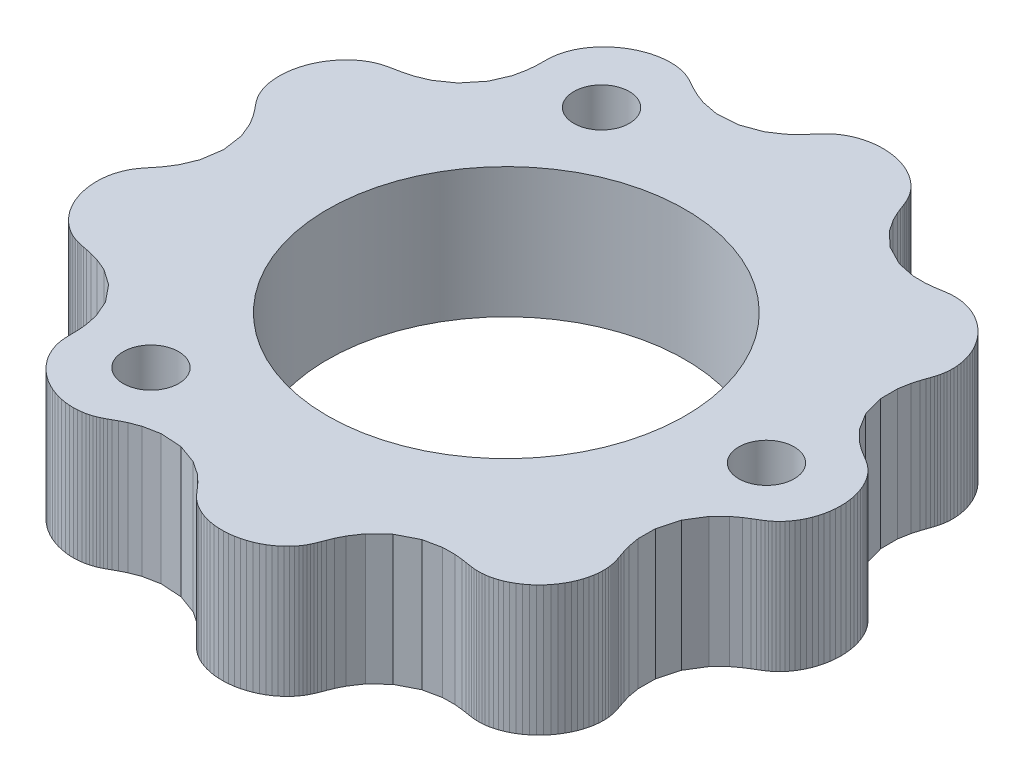
from build123d import *

# Parameters (mm, degrees)
SKETCH1_R           = 8.73125
BOSS_EXTRUDE1_DEPTH = 6.35
SKETCH2_R           = 1.35255
CUT_EXTRUDE1_DEPTH  = 25.155143673


with BuildPart() as part:
    # Sketch1 → Boss-Extrude1 (new body)
    with BuildSketch(Plane(origin=(0, 0, 0), x_dir=(1, 0, 0), z_dir=(0, 1, 0))):
        Polygon((13.158625694, 2.896830869), (12.791263425, 3.170142616), (12.291349818, 3.669343614), (11.77870952, 4.496612993), (11.502906417, 5.500558598), (11.499130591, 6.333845387), (11.598412818, 6.883171823), (11.697750704, 7.22707793), (11.774159157, 7.453194447), (11.830874176, 7.617056094), (11.874650737, 7.750735367), (11.910311798, 7.872982033), (11.94024632, 7.995078537), (11.964947846, 8.123889112), (11.983624956, 8.263460612), (11.994696284, 8.415902035), (11.996165513, 8.58190094), (11.985903403, 8.761053922), (11.961861475, 8.952100578), (11.922234402, 9.15310695), (11.865582106, 9.361622282), (11.790918419, 9.574821298), (11.69777069, 9.789637839), (11.586213208, 10.002892144), (11.456876573, 10.211411964), (11.310934746, 10.412146557), (11.150071414, 10.602271901), (10.976427312, 10.779285127), (10.792530246, 10.941086065), (10.601209599, 11.086043732), (10.40549712, 11.21304574), (10.208515647, 11.32152862), (10.013357043, 11.411487218), (9.82294991, 11.483461233), (9.639916308, 11.53849685), (9.466414428, 11.578080931), (9.30396013, 11.604044362), (9.153213125, 11.618429715), (9.013700532, 11.623316296), (8.883425976, 11.620593564), (8.758264909, 11.6116747), (8.630953094, 11.597157727), (8.489288819, 11.576514925), (8.312816024, 11.548173385), (8.066774888, 11.511359518), (7.692825719, 11.474374893), (7.106780789, 11.481262171), (6.260742916, 11.657086194), (5.327653237, 12.13682498), (4.639141336, 12.78973614), (4.263548607, 13.350931054), (4.072540039, 13.74249338), (3.96571592, 14.00500093), (3.895355597, 14.189369897), (3.840055292, 14.331162601), (3.78908175, 14.4523302), (3.735998369, 14.565875167), (3.676260973, 14.679167745), (3.606331959, 14.795973888), (3.523370431, 14.917683018), (3.425141503, 15.044078008), (3.310005363, 15.173845889), (3.176929193, 15.304939372), (3.025497932, 15.434849523), (2.855913644, 15.56082269), (2.668979383, 15.680039768), (2.466066333, 15.789767513), (2.249064552, 15.887486884), (2.020318509, 15.97100072), (1.782549186, 16.03852155), (1.538764919, 16.088739506), (1.292163415, 16.120869989), (1.046027604, 16.134680539), (0.803618049, 16.130496436), (0.568064656, 16.109184558), (0.342260296, 16.072115088), (0.128758713, 16.021100558), (-0.070321364, 15.95831139), (-0.25338471, 15.886166371), (-0.419440656, 15.807195119), (-0.568178667, 15.723867047), (-0.700043841, 15.638376887), (-0.816324214, 15.552369091), (-0.919274444, 15.466569786), (-1.012326753, 15.380271393), (-1.100497133, 15.29057548), (-1.191224754, 15.191240524), (-1.296190042, 15.070928162), (-1.435378112, 14.910789352), (-1.646084076, 14.682725665), (-2.000012249, 14.356636581), (-2.613301094, 13.945903473), (-3.547999163, 13.604802593), (-4.575306363, 13.541411116), (-5.361953094, 13.696601946), (-5.857746817, 13.887956118), (-6.162987487, 14.040370311), (-6.363853429, 14.150825572), (-6.511128594, 14.232604381), (-6.633373325, 14.297501726), (-6.747227712, 14.353063522), (-6.862833226, 14.403257917), (-6.986525121, 14.449529229), (-7.122199157, 14.491649229), (-7.272041556, 14.528334005), (-7.436947664, 14.557686634), (-7.616786074, 14.577521332), (-7.810585812, 14.585606925), (-8.016685841, 14.579853108), (-8.232866897, 14.558453609), (-8.456475656, 14.519994651), (-8.684545759, 14.463533736), (-8.913917171, 14.388651827), (-9.141353569, 14.295480952), (-9.363656383, 14.184708755), (-9.577773559, 14.05756128), (-9.780900751, 13.915765289), (-9.970572544, 13.761491449), (-10.144741292, 13.597279778), (-10.301841251, 13.425948779), (-10.440835788, 13.250489495), (-10.561245616, 13.073945381), (-10.663156095, 12.89927809), (-10.747201692, 12.729217869), (-10.81452563, 12.566094758), (-10.866712592, 12.411642411), (-10.905692153, 12.266758579), (-10.933610967, 12.13119217), (-10.952674341, 12.003100465), (-10.964968267, 11.878369921), (-10.972309201, 11.749497674), (-10.976288171, 11.603647792), (-10.979061961, 11.419183026), (-10.986666406, 11.159717242), (-11.020081461, 10.766496124), (-11.144274781, 10.16421872), (-11.497556725, 9.343084609), (-12.161374156, 8.525342821), (-12.918032965, 7.99800603), (-13.512853147, 7.749296534), (-13.91254669, 7.63914869), (-14.177831781, 7.583264075), (-14.365091893, 7.547321403), (-14.511050114, 7.517816519), (-14.637879771, 7.488456876), (-14.758703456, 7.455312864), (-14.881069396, 7.415243397), (-15.008976339, 7.365449518), (-15.144066548, 7.303406745), (-15.286361475, 7.226916435), (-15.434745313, 7.134184503), (-15.58730681, 7.023894503), (-15.741598733, 6.895263384), (-15.894847072, 6.748076118), (-16.044127287, 6.58269853), (-16.186516651, 6.400068908), (-16.319227166, 6.201669636), (-16.439720885, 5.989480459), (-16.545807973, 5.765915285), (-16.635727085, 5.533744701), (-16.708207199, 5.296006556), (-16.762509962, 5.055907141), (-16.798451558, 4.816715583), (-16.816403204, 4.581654056), (-16.817269391, 4.353786303), (-16.80244296, 4.135906655), (-16.773735786, 3.930431239), (-16.733283256, 3.739292143), (-16.683419422, 3.56383386), (-16.626517462, 3.404708787), (-16.56478603, 3.261764073), (-16.500005161, 3.133903861), (-16.43317353, 3.0188949), (-16.364019144, 2.913050998), (-16.290295373, 2.810663059), (-16.206749366, 2.702890306), (-16.103662751, 2.575486665), (-15.96520381, 2.403995134), (-15.769763324, 2.143864402), (-15.502439396, 1.714513582), (-15.207563438, 1.003228947), (-15.061665617, 0), (-15.207563438, -1.003228947), (-15.502439396, -1.714513582), (-15.769763324, -2.143864402), (-15.96520381, -2.403995134), (-16.103662751, -2.575486665), (-16.206749366, -2.702890306), (-16.290295373, -2.810663059), (-16.364019144, -2.913050998), (-16.43317353, -3.0188949), (-16.500005161, -3.133903861), (-16.56478603, -3.261764073), (-16.626517462, -3.404708787), (-16.683419422, -3.56383386), (-16.733283256, -3.739292143), (-16.773735786, -3.930431239), (-16.80244296, -4.135906655), (-16.817269391, -4.353786303), (-16.816403204, -4.581654056), (-16.798451558, -4.816715583), (-16.762509962, -5.055907141), (-16.708207199, -5.296006556), (-16.635727085, -5.533744701), (-16.545807973, -5.765915285), (-16.439720885, -5.989480459), (-16.319227166, -6.201669636), (-16.186516651, -6.400068908), (-16.044127287, -6.58269853), (-15.894847072, -6.748076118), (-15.741598733, -6.895263384), (-15.58730681, -7.023894503), (-15.434745313, -7.134184503), (-15.286361475, -7.226916435), (-15.144066548, -7.303406745), (-15.008976339, -7.365449518), (-14.881069396, -7.415243397), (-14.758703456, -7.455312864), (-14.637879771, -7.488456876), (-14.511050114, -7.517816519), (-14.365091893, -7.547321403), (-14.177831781, -7.583264075), (-13.91254669, -7.63914869), (-13.512853147, -7.749296534), (-12.918032965, -7.99800603), (-12.161374156, -8.525342821), (-11.497556725, -9.343084609), (-11.144274781, -10.16421872), (-11.020081461, -10.766496124), (-10.986666406, -11.159717242), (-10.979061961, -11.419183026), (-10.976288171, -11.603647792), (-10.972309201, -11.749497674), (-10.964968267, -11.878369921), (-10.952674341, -12.003100465), (-10.933610967, -12.13119217), (-10.905692153, -12.266758579), (-10.866712592, -12.411642411), (-10.81452563, -12.566094758), (-10.747201692, -12.729217869), (-10.663156095, -12.89927809), (-10.561245616, -13.073945381), (-10.440835788, -13.250489495), (-10.301841251, -13.425948779), (-10.144741292, -13.597279778), (-9.970572544, -13.761491449), (-9.780900751, -13.915765289), (-9.577773559, -14.05756128), (-9.363656383, -14.184708755), (-9.141353569, -14.295480952), (-8.913917171, -14.388651827), (-8.684545759, -14.463533736), (-8.456475656, -14.519994651), (-8.232866897, -14.558453609), (-8.016685841, -14.579853108), (-7.810585812, -14.585606925), (-7.616786074, -14.577521332), (-7.436947664, -14.557686634), (-7.272041556, -14.528334005), (-7.122199157, -14.491649229), (-6.986525121, -14.449529229), (-6.862833226, -14.403257917), (-6.747227712, -14.353063522), (-6.633373325, -14.297501726), (-6.511128594, -14.232604381), (-6.363853429, -14.150825572), (-6.162987487, -14.040370311), (-5.857746817, -13.887956118), (-5.361953094, -13.696601946), (-4.575306363, -13.541411116), (-3.547999163, -13.604802593), (-2.613301094, -13.945903473), (-2.000012249, -14.356636581), (-1.646084076, -14.682725665), (-1.435378112, -14.910789352), (-1.296190042, -15.070928162), (-1.191224754, -15.191240524), (-1.100497133, -15.29057548), (-1.012326753, -15.380271393), (-0.919274444, -15.466569786), (-0.816324214, -15.552369091), (-0.700043841, -15.638376887), (-0.568178667, -15.723867047), (-0.419440656, -15.807195119), (-0.25338471, -15.886166371), (-0.070321364, -15.95831139), (0.128758713, -16.021100558), (0.342260296, -16.072115088), (0.568064656, -16.109184558), (0.803618049, -16.130496436), (1.046027604, -16.134680539), (1.292163415, -16.120869989), (1.538764919, -16.088739506), (1.782549186, -16.03852155), (2.020318509, -15.97100072), (2.249064552, -15.887486884), (2.466066333, -15.789767513), (2.668979383, -15.680039768), (2.855913644, -15.56082269), (3.025497932, -15.434849523), (3.176929193, -15.304939372), (3.310005363, -15.173845889), (3.425141503, -15.044078008), (3.523370431, -14.917683018), (3.606331959, -14.795973888), (3.676260973, -14.679167745), (3.735998369, -14.565875167), (3.78908175, -14.4523302), (3.840055292, -14.331162601), (3.895355597, -14.189369897), (3.96571592, -14.00500093), (4.072540039, -13.74249338), (4.263548607, -13.350931054), (4.639141336, -12.78973614), (5.327653237, -12.13682498), (6.260742916, -11.657086194), (7.106780789, -11.481262171), (7.692825719, -11.474374893), (8.066774888, -11.511359518), (8.312816024, -11.548173385), (8.489288819, -11.576514925), (8.630953094, -11.597157727), (8.758264909, -11.6116747), (8.883425976, -11.620593564), (9.013700532, -11.623316296), (9.153213125, -11.618429715), (9.30396013, -11.604044362), (9.466414428, -11.578080931), (9.639916308, -11.53849685), (9.82294991, -11.483461233), (10.013357043, -11.411487218), (10.208515647, -11.32152862), (10.40549712, -11.21304574), (10.601209599, -11.086043732), (10.792530246, -10.941086065), (10.976427312, -10.779285127), (11.150071414, -10.602271901), (11.310934746, -10.412146557), (11.456876573, -10.211411964), (11.586213208, -10.002892144), (11.69777069, -9.789637839), (11.790918419, -9.574821298), (11.865582106, -9.361622282), (11.922234402, -9.15310695), (11.961861475, -8.952100578), (11.985903403, -8.761053922), (11.996165513, -8.58190094), (11.994696284, -8.415902035), (11.983624956, -8.263460612), (11.964947846, -8.123889112), (11.94024632, -7.995078537), (11.910311798, -7.872982033), (11.874650737, -7.750735367), (11.830874176, -7.617056094), (11.774159157, -7.453194447), (11.697750704, -7.22707793), (11.598412818, -6.883171823), (11.499130591, -6.333845387), (11.502906417, -5.500558598), (11.77870952, -4.496612993), (12.291349818, -3.669343614), (12.791263425, -3.170142616), (13.158625694, -2.896830869), (13.408930458, -2.73784625), (13.584341614, -2.632733463), (13.717588449, -2.552044195), (13.829541203, -2.480428751), (13.932622305, -2.408840541), (14.033773805, -2.331288733), (14.136398272, -2.243489494), (14.241574904, -2.142296138), (14.348837786, -2.025454435), (14.45669787, -1.891494238), (14.563013637, -1.739675236), (14.665269391, -1.56994962), (14.760794066, -1.382924429), (14.846938825, -1.179815696), (14.921223434, -0.962391162), (14.981456788, -0.732900817), (15.025834231, -0.493995911), (15.053012917, -0.248637985), (15.062165593, 0), (15.053012917, 0.248637985), (15.025834231, 0.493995911), (14.981456788, 0.732900817), (14.921223434, 0.962391162), (14.846938825, 1.179815696), (14.760794066, 1.382924429), (14.665269391, 1.56994962), (14.563013637, 1.739675236), (14.45669787, 1.891494238), (14.348837786, 2.025454435), (14.241574904, 2.142296138), (14.136398272, 2.243489494), (14.033773805, 2.331288733), (13.932622305, 2.408840541), (13.829541203, 2.480428751), (13.717588449, 2.552044195), (13.584341614, 2.632733463), (13.408930458, 2.73784625), align=None)
        with Locations((-1.27, 0)):
            Circle(SKETCH1_R, mode=Mode.SUBTRACT)
    extrude(amount=BOSS_EXTRUDE1_DEPTH)

    # Sketch2 → Cut-Extrude1 (cut, through all)
    with BuildSketch(Plane(origin=(0, 6.35, 0), x_dir=(1, 0, 0), z_dir=(0, 1, 0))):
        with Locations((11.43, 0)):
            Circle(SKETCH2_R)
        with Locations((-7.62, -10.998522628)):
            Circle(SKETCH2_R)
        with Locations((-7.62, 10.998522628)):
            Circle(SKETCH2_R)
    extrude(amount=-CUT_EXTRUDE1_DEPTH, mode=Mode.SUBTRACT)


solid = part.part
